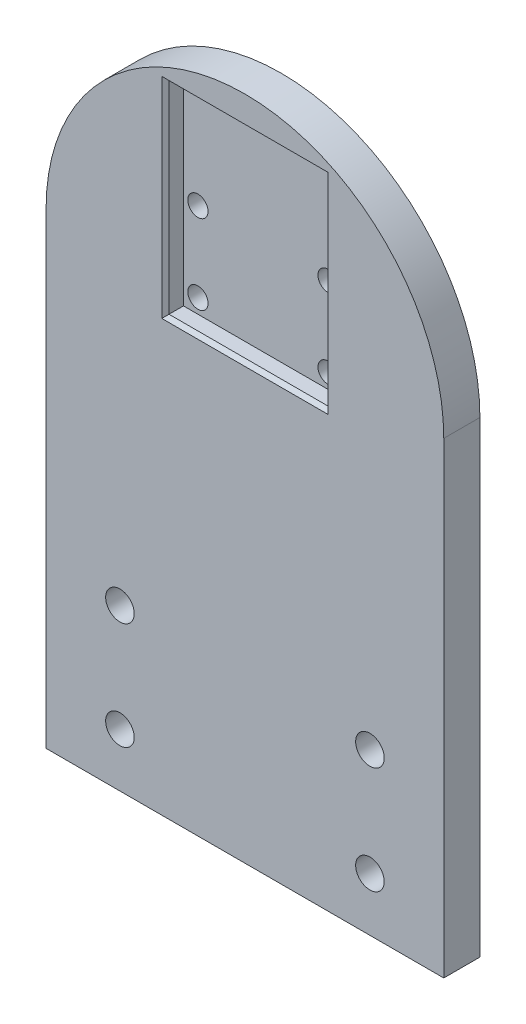
from build123d import *

# Parameters (mm, degrees)
SKETCH_1_R          = 1.975693944
EXTRUDE_1_DEPTH     = 5
SKETCH_2_W          = 22
SKETCH_2_H          = 28
CUT_EXTRUDE_1_DEPTH = 2.5
CHAMFER_1_SIZE      = 0.5
SKETCH_3_R          = 1.4
CUT_EXTRUDE_2_DEPTH = 2.5


with BuildPart() as part:
    # 草图1 → 凸台-拉伸1 (new body)
    with BuildSketch(Plane.XY):
        with BuildLine():
            Line((-27.5, -14.817704584), (27.5, -14.817704584))
            Line((27.5, -14.817704584), (27.5, 14.817704584))
            Line((27.5, 14.817704584), (27.5, 49.817704584))
            ThreePointArc((27.5, 49.817704584), (0, 77.317704584), (-27.5, 49.817704584))
            Line((-27.5, 49.817704584), (-27.5, 14.817704584))
            Line((-27.5, 14.817704584), (-27.5, -14.817704584))
        make_face()
        with Locations((-17.287322014, 7.408852292)):
            Circle(SKETCH_1_R, mode=Mode.SUBTRACT)
        with Locations((17.287322014, 7.408852292)):
            Circle(SKETCH_1_R, mode=Mode.SUBTRACT)
        with Locations((17.287322014, -7.408852292)):
            Circle(SKETCH_1_R, mode=Mode.SUBTRACT)
        with Locations((-17.287322014, -7.408852292)):
            Circle(SKETCH_1_R, mode=Mode.SUBTRACT)
    extrude(amount=EXTRUDE_1_DEPTH)

    # 草图2 → 切除-拉伸1 (cut)
    with BuildSketch(Plane.XY.offset(5)):
        with Locations((0, 59.182295416)):
            Rectangle(SKETCH_2_W, SKETCH_2_H)
    extrude(amount=-CUT_EXTRUDE_1_DEPTH, mode=Mode.SUBTRACT)

    # 倒角1
    chamfer_1_edges = [part.edges().sort_by_distance(p)[0] for p in [
        (11, 59.182295416, 5),
        (0, 45.182295416, 5),
        (-11, 59.182295416, 5),
        (0, 73.182295416, 5),
    ]]
    chamfer(chamfer_1_edges, length=CHAMFER_1_SIZE)

    # 草图3 → 切除-拉伸2 (cut)
    with BuildSketch(Plane.XY.offset(2.5)):
        with Locations((-9, 58.182295416)):
            Circle(SKETCH_3_R)
        with Locations((9, 58.182295416)):
            Circle(SKETCH_3_R)
        with Locations((-9, 47.182295416)):
            Circle(SKETCH_3_R)
        with Locations((9, 47.182295416)):
            Circle(SKETCH_3_R)
    extrude(amount=-CUT_EXTRUDE_2_DEPTH, mode=Mode.SUBTRACT)


solid = part.part
